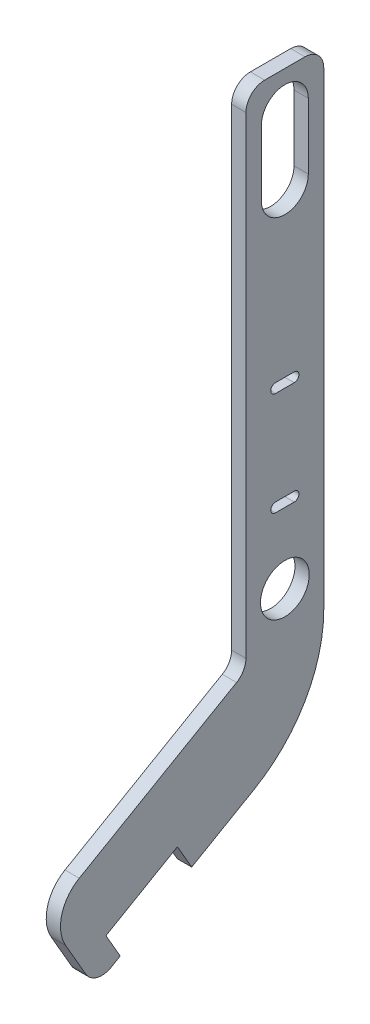
from build123d import *

# Parameters (mm, degrees)
SKETCH1_R            = 2.6
BASE_FLANGE1_DEPTH   = 1.524
KEYING_DEPTH         = 10
FILLET1_R            = 2
FILLET2_R            = 4
JOG1_START           = -33.370112718
JOG1_DEPTH           = 8.3
JOG1_2_DEPTH         = 8.3
JOG1_START_2         = 10.476
JOG1_3_DEPTH         = 1.524
CUT_EXTRUDE1_DEPTH   = 12
CUT_EXTRUDE1_START   = -1.524
CUT_EXTRUDE1_2_DEPTH = 1.524
CUT_EXTRUDE1_3_DEPTH = 1.524


with BuildPart() as part:
    # Base-Flange1: sheet metal written as solids
    # Sketch1 → Base-Flange1 (new body)
    with BuildSketch(Plane(origin=(0, 0, 0), x_dir=(0, 0, -1), z_dir=(1, 0, 0))):
        with BuildLine():
            Line((33.370112718, 22.8), (33.370112718, 64.8))
            Line((33.370112718, 64.8), (25.070112718, 64.8))
            Line((25.070112718, 64.8), (25.070112718, 21.281826676))
            Line((25.070112718, 21.281826676), (3.832112718, 9.020061659))
            Line((3.832112718, 9.020061659), (8.220112718, 1.419822715))
            Line((8.220112718, 1.419822715), (8.982112718, 0.1))
            Line((8.982112718, 0.1), (25.905336052, 9.870627547))
            ThreePointArc((25.905336052, 9.870627547), (31.369931839, 15.335223334), (33.370112718, 22.8))
        make_face()
        with Locations((29.220112718, 26.8)):
            Circle(SKETCH1_R, mode=Mode.SUBTRACT)
        with BuildLine():
            Line((31.720112718, 60.8), (31.720112718, 53.8))
            ThreePointArc((31.720112718, 53.8), (29.220112718, 51.3), (26.720112718, 53.8))
            Line((26.720112718, 53.8), (26.720112718, 60.8))
            ThreePointArc((26.720112718, 60.8), (29.220112718, 63.3), (31.720112718, 60.8))
        make_face(mode=Mode.SUBTRACT)
    extrude(amount=-BASE_FLANGE1_DEPTH)

    # Sketch6 → Keying (cut)
    with BuildSketch(Plane(origin=(0, 0, 0), x_dir=(0, 0, -1), z_dir=(1, 0, 0))):
        Polygon((19.287815023, 6.05), (17.763815023, 8.689645431), (13.953303246, 6.489645431), (10.14279147, 4.289645431), (11.66679147, 1.65), (15.701110868, 3.97921539), align=None)
    extrude(amount=-KEYING_DEPTH, mode=Mode.SUBTRACT)

    # Fillet1
    fillet1_edges = [part.edges().sort_by_distance(p)[0] for p in [
        (-0.762, 0.1, -8.982112718),
        (-0.762, 21.281826676, -25.070112718),
        (-0.762, 64.8, -25.070112718),
        (-0.762, 64.8, -33.370112718),
    ]]
    fillet(fillet1_edges, radius=FILLET1_R)

    # Fillet2
    fillet2_edges = [part.edges().sort_by_distance(p)[0] for p in [
        (-0.762, 9.020061659, -3.832112718),
    ]]
    fillet(fillet2_edges, radius=FILLET2_R)

    # Jog1: read off the stored shape, not the designer's step
    # Jog1 outline → Jog1 (cut)
    with BuildSketch(Plane.XY.offset(JOG1_START)):
        with BuildLine():
            ThreePointArc((-1.524, 33.004579798), (-1.115645431, 34.528579798), (0, 35.644225229))
            Line((0, 35.644225229), (0, 64.8))
            Line((0, 64.8), (-1.524, 64.8))
            Line((-1.524, 64.8), (-1.524, 33.004579798))
        make_face()
    extrude(amount=JOG1_DEPTH, mode=Mode.SUBTRACT)

    # Jog1 2 outline → Jog1 2 (add)
    with BuildSketch(Plane.XY.offset(JOG1_START)):
        with BuildLine():
            ThreePointArc((0, 33.004579798), (0.446369265, 34.082210533), (1.524, 34.528579798))
            Line((1.524, 34.528579798), (8.952, 34.528579798))
            ThreePointArc((8.952, 34.528579798), (11.107261469, 35.421318329), (12, 37.576579798))
            Line((12, 37.576579798), (12, 64.8))
            Line((12, 64.8), (10.476, 64.8))
            Line((10.476, 64.8), (10.476, 37.576579798))
            ThreePointArc((10.476, 37.576579798), (10.029630734, 36.498949063), (8.952, 36.052579798))
            Line((8.952, 36.052579798), (1.524, 36.052579798))
            ThreePointArc((1.524, 36.052579798), (0.73511955, 35.948721717), (0, 35.644225229))
            Line((0, 35.644225229), (0, 33.004579798))
        make_face()
    extrude(amount=JOG1_2_DEPTH)

    # Jog1 3 outline → Jog1 3 (cut)
    with BuildSketch(Plane.YZ.offset(JOG1_START_2)):
        with BuildLine():
            ThreePointArc((62.8, -25.070112718), (64.214213562, -25.655899156), (64.8, -27.070112718))
            Line((64.8, -27.070112718), (64.8, -25.070112718))
            Line((64.8, -25.070112718), (62.8, -25.070112718))
        make_face()
        with BuildLine():
            ThreePointArc((64.8, -31.370112718), (64.214213562, -32.78432628), (62.8, -33.370112718))
            Line((62.8, -33.370112718), (64.8, -33.370112718))
            Line((64.8, -33.370112718), (64.8, -31.370112718))
        make_face()
        with BuildLine():
            Line((60.8, -26.720112718), (53.8, -26.720112718))
            ThreePointArc((53.8, -26.720112718), (51.3, -29.220112718), (53.8, -31.720112718))
            Line((53.8, -31.720112718), (60.8, -31.720112718))
            ThreePointArc((60.8, -31.720112718), (63.3, -29.220112718), (60.8, -26.720112718))
        make_face()
    extrude(amount=JOG1_3_DEPTH, mode=Mode.SUBTRACT)

    # Cut-Extrude1: read off the stored shape, not the designer's step
    # Cut-Extrude1 outline → Cut-Extrude1 (cut)
    with BuildSketch(Plane(origin=(0, 0, 0), x_dir=(0, 0, -1), z_dir=(1, 0, 0))):
        with BuildLine():
            Line((25.070112718, 32), (33.370112718, 32))
            Line((33.370112718, 32), (33.370112718, 62.8))
            ThreePointArc((33.370112718, 62.8), (32.78432628, 64.214213562), (31.370112718, 64.8))
            Line((31.370112718, 64.8), (27.070112718, 64.8))
            ThreePointArc((27.070112718, 64.8), (25.655899156, 64.214213562), (25.070112718, 62.8))
            Line((25.070112718, 62.8), (25.070112718, 32))
        make_face()
        with BuildLine():
            ThreePointArc((26.720112718, 60.8), (29.220112718, 63.3), (31.720112718, 60.8))
            Line((31.720112718, 60.8), (31.720112718, 53.8))
            ThreePointArc((31.720112718, 53.8), (29.220112718, 51.3), (26.720112718, 53.8))
            Line((26.720112718, 53.8), (26.720112718, 60.8))
        make_face(mode=Mode.SUBTRACT)
    extrude(amount=CUT_EXTRUDE1_DEPTH, mode=Mode.SUBTRACT)

    # Cut-Extrude1 2 outline → Cut-Extrude1 2 (cut)
    with BuildSketch(Plane(origin=(0, 0, 0), x_dir=(0, 0, -1), z_dir=(1, 0, 0)).offset(CUT_EXTRUDE1_START)):
        with BuildLine():
            ThreePointArc((28.220112718, 35.3), (27.720112718, 34.8), (28.220112718, 34.3))
            Line((28.220112718, 34.3), (30.220112718, 34.3))
            ThreePointArc((30.220112718, 34.3), (30.720112718, 34.8), (30.220112718, 35.3))
            Line((30.220112718, 35.3), (28.220112718, 35.3))
        make_face()
    extrude(amount=CUT_EXTRUDE1_2_DEPTH, mode=Mode.SUBTRACT)

    # Cut-Extrude1 3 outline → Cut-Extrude1 3 (add)
    with BuildSketch(Plane(origin=(0, 0, 0), x_dir=(0, 0, -1), z_dir=(1, 0, 0)).offset(CUT_EXTRUDE1_START)):
        with BuildLine():
            Line((25.070112718, 32), (33.370112718, 32))
            Line((33.370112718, 32), (33.370112718, 72.837680806))
            ThreePointArc((33.370112718, 72.837680806), (32.78432628, 74.251894368), (31.370112718, 74.837680806))
            Line((31.370112718, 74.837680806), (27.070112718, 74.837680806))
            ThreePointArc((27.070112718, 74.837680806), (25.655899156, 74.251894368), (25.070112718, 72.837680806))
            Line((25.070112718, 72.837680806), (25.070112718, 32))
        make_face()
        with BuildLine():
            ThreePointArc((28.220112718, 34.3), (27.720112718, 34.8), (28.220112718, 35.3))
            Line((28.220112718, 35.3), (30.220112718, 35.3))
            ThreePointArc((30.220112718, 35.3), (30.720112718, 34.8), (30.220112718, 34.3))
            Line((30.220112718, 34.3), (28.220112718, 34.3))
        make_face(mode=Mode.SUBTRACT)
        with BuildLine():
            Line((28.220112718, 46.318840403), (30.220112718, 46.318840403))
            ThreePointArc((30.220112718, 46.318840403), (30.720112718, 45.818840403), (30.220112718, 45.318840403))
            Line((30.220112718, 45.318840403), (28.220112718, 45.318840403))
            ThreePointArc((28.220112718, 45.318840403), (27.720112718, 45.818840403), (28.220112718, 46.318840403))
        make_face(mode=Mode.SUBTRACT)
        with BuildLine():
            Line((26.720112718, 63.837680806), (26.720112718, 70.837680806))
            ThreePointArc((26.720112718, 70.837680806), (29.220112718, 73.337680806), (31.720112718, 70.837680806))
            Line((31.720112718, 70.837680806), (31.720112718, 63.837680806))
            ThreePointArc((31.720112718, 63.837680806), (29.220112718, 61.337680806), (26.720112718, 63.837680806))
        make_face(mode=Mode.SUBTRACT)
    extrude(amount=CUT_EXTRUDE1_3_DEPTH)


solid = part.part
